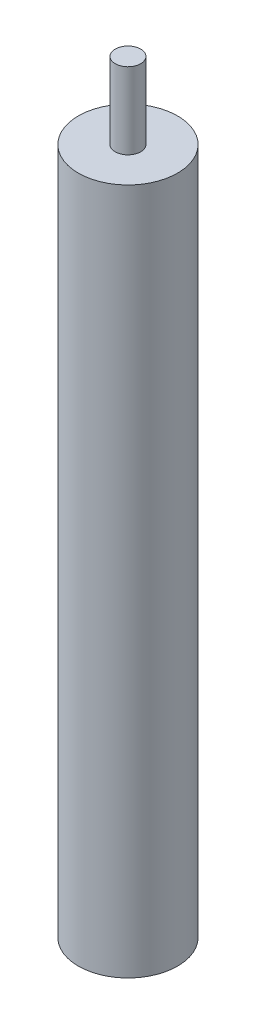
from build123d import *

# Parameters (mm, degrees)
SKETCH1_R           = 1.95
BOSS_EXTRUDE1_DEPTH = 27
SKETCH2_R           = 0.5
BOSS_EXTRUDE2_DEPTH = 3


with BuildPart() as part:
    # Sketch1 → Boss-Extrude1 (new body)
    with BuildSketch(Plane(origin=(0, 0, 0), x_dir=(1, 0, 0), z_dir=(0, 1, 0))):
        with Locations((-2.949240541, 0.333822696)):
            Circle(SKETCH1_R)
    extrude(amount=BOSS_EXTRUDE1_DEPTH)

    # Sketch2 → Boss-Extrude2 (add)
    with BuildSketch(Plane(origin=(0, 27, 0), x_dir=(1, 0, 0), z_dir=(0, 1, 0))):
        with Locations((-2.949240541, 0.333822696)):
            Circle(SKETCH2_R)
    extrude(amount=BOSS_EXTRUDE2_DEPTH)


solid = part.part
